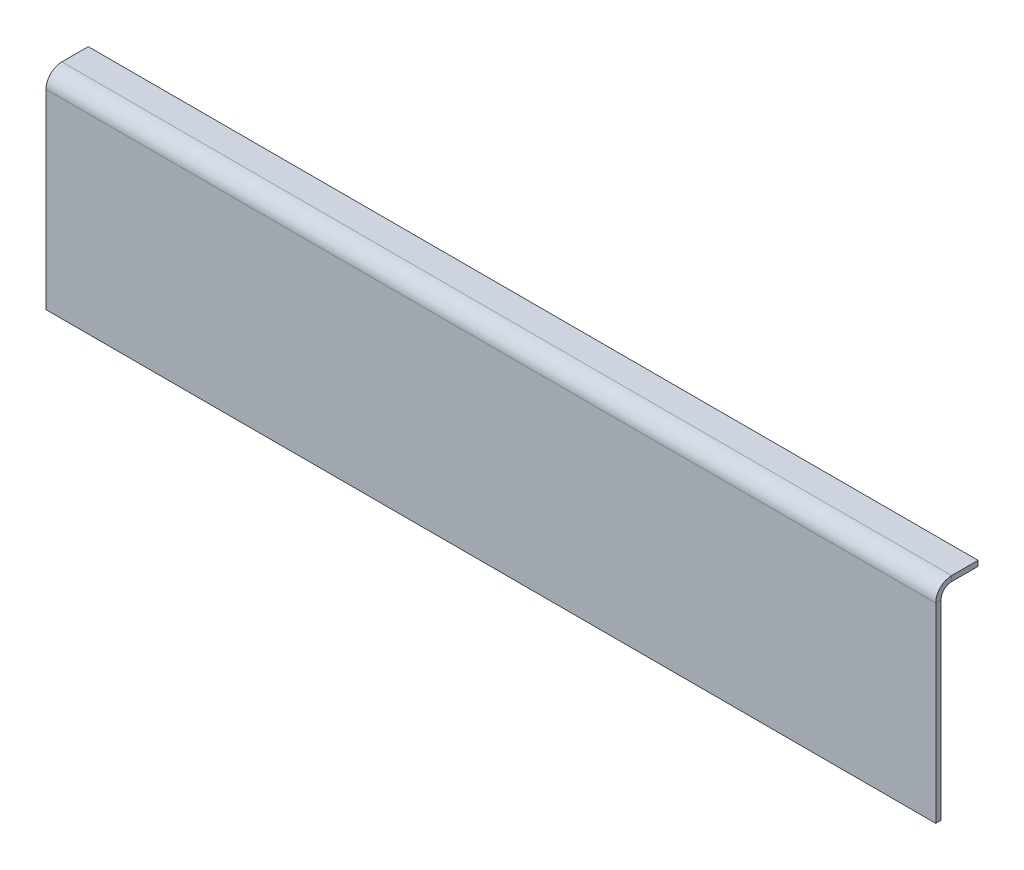
from build123d import *

# Parameters (mm, degrees)
SKETCH1_W                    = 534.99766
SKETCH1_H                    = 121.1072
BASE_FLANGE1_DEPTH           = 3.175
EDGE_FLANGE1_STRIP_W         = 25.4
EDGE_FLANGE1_STRIP_H         = 3.175
EDGE_FLANGE1_STRIP_CUT_DEPTH = 534.99766
EDGE_FLANGE1_DEPTH           = 534.99766


# Sheet-metal steps are written as plain solids
with BuildPart() as part:
    # Sketch1 → Base-Flange1 (new body)
    with BuildSketch(Plane.XY):
        with Locations((267.49883, 60.5536)):
            Rectangle(SKETCH1_W, SKETCH1_H)
    extrude(amount=-BASE_FLANGE1_DEPTH)

    # Edge-Flange1 strip (across the edge) → Edge-Flange1 strip cut (cut)
    with BuildSketch(Plane(origin=(0, 121.1072, -3.175), x_dir=(0, -1, 0), z_dir=(1, 0, 0))):
        with Locations((-6.35, -1.5875)):
            Rectangle(EDGE_FLANGE1_STRIP_W, EDGE_FLANGE1_STRIP_H)
    extrude(amount=EDGE_FLANGE1_STRIP_CUT_DEPTH, mode=Mode.SUBTRACT)

    # Edge-Flange1 section (across the edge) → Edge-Flange1 (add)
    with BuildSketch(Plane(origin=(0, 121.1072, -3.175), x_dir=(0, -1, 0), z_dir=(1, 0, 0))):
        with BuildLine():
            Line((-3.175, 6.35), (-3.175, 22.225))
            Line((-3.175, 22.225), (0, 22.225))
            Line((0, 22.225), (0, 6.35))
            ThreePointArc((0, 6.35), (1.859871939, 1.859871939), (6.35, 0))
            Line((6.35, 0), (6.35, -3.175))
            ThreePointArc((6.35, -3.175), (-0.385192091, -0.385192091), (-3.175, 6.35))
        make_face()
    extrude(amount=EDGE_FLANGE1_DEPTH)


solid = part.part
